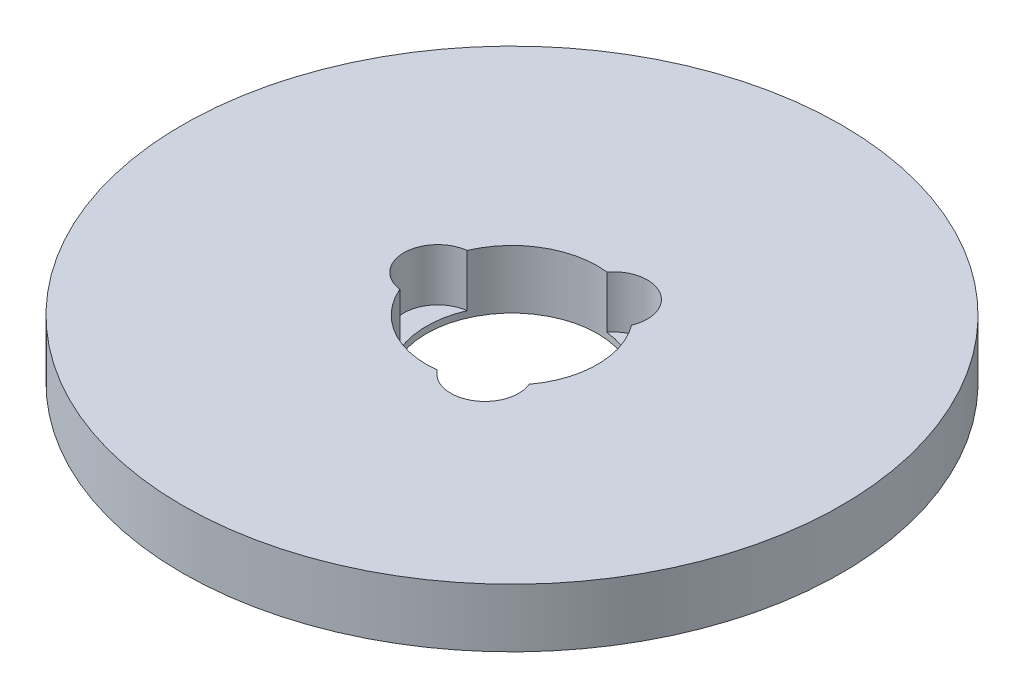
from build123d import *

# Parameters (mm, degrees)
SKETCH1_R           = 67.5
BOSS_EXTRUDE1_DEPTH = 12
SKETCH2_R           = 17.5
CUT_EXTRUDE1_DEPTH  = 97.210706265
SKETCH3_R           = 6.954495444
CUT_EXTRUDE2_DEPTH  = 10.687332769
CIRPATTERN1_COUNT   = 3


with BuildPart() as part:
    # Sketch1 → Boss-Extrude1 (new body)
    with BuildSketch(Plane(origin=(0, 0, 0), x_dir=(1, 0, 0), z_dir=(0, 1, 0))):
        Circle(SKETCH1_R)
    extrude(amount=BOSS_EXTRUDE1_DEPTH)

    # Sketch2 → Cut-Extrude1 (cut, through all)
    with BuildSketch(Plane(origin=(0, 0, 0), x_dir=(1, 0, 0), z_dir=(0, 1, 0))):
        Circle(SKETCH2_R)
    extrude(amount=CUT_EXTRUDE1_DEPTH, mode=Mode.SUBTRACT)

    # Sketch3 → Cut-Extrude2 (cut)
    with BuildSketch(Plane(origin=(0, 12, 0), x_dir=(1, 0, 0), z_dir=(0, 1, 0))):
        with Locations((-15.205449086, 0)):
            Circle(SKETCH3_R)
    cut_extrude2 = extrude(amount=-CUT_EXTRUDE2_DEPTH, mode=Mode.SUBTRACT)

    # CirPattern1: Cut-Extrude2 ×3 about axis
    cirpattern1_axis = Axis((0, 0, 0), (0, 1, 0))
    for i in range(1, CIRPATTERN1_COUNT):
        add(cut_extrude2.rotate(cirpattern1_axis, i * 360 / CIRPATTERN1_COUNT), mode=Mode.SUBTRACT)


solid = part.part
